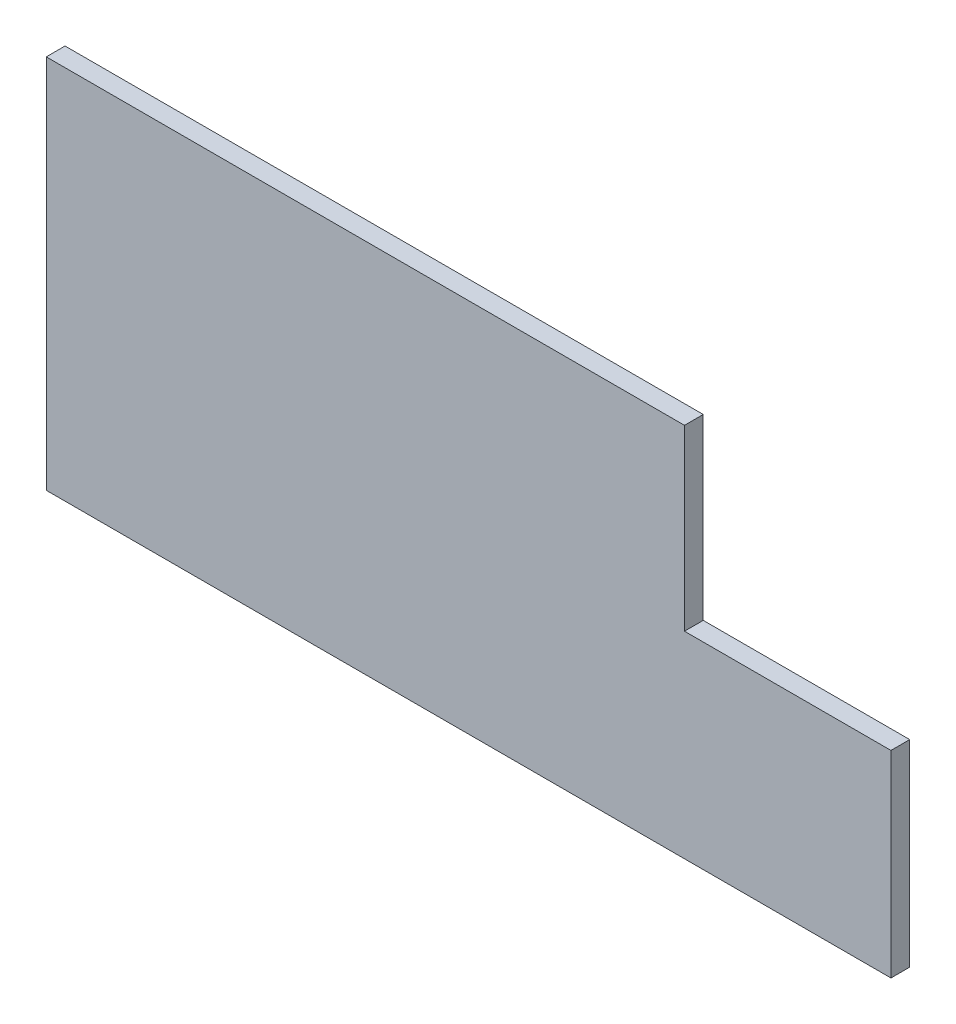
from build123d import *

# Parameters (mm, degrees)
ESQUISSE1_W        = 170
ESQUISSE1_H        = 100
BOSS_EXTRU_1_DEPTH = 5
ESQUISSE2_W        = 5
ESQUISSE2_H        = 52.5
BOSS_EXTRU_2_DEPTH = 55


with BuildPart() as part:
    # Esquisse1 → Boss.-Extru.1 (new body)
    with BuildSketch(Plane.XY):
        with Locations((-18.588292944, -1.358695652)):
            Rectangle(ESQUISSE1_W, ESQUISSE1_H)
    extrude(amount=BOSS_EXTRU_1_DEPTH)

    # Esquisse2 → Boss.-Extru.2 (add)
    with BuildSketch(Plane(origin=(66.411707056, 0, 0), x_dir=(0, 0, -1), z_dir=(1, 0, 0))):
        with Locations((-2.5, -25.108695652)):
            Rectangle(ESQUISSE2_W, ESQUISSE2_H)
    extrude(amount=BOSS_EXTRU_2_DEPTH)


solid = part.part
